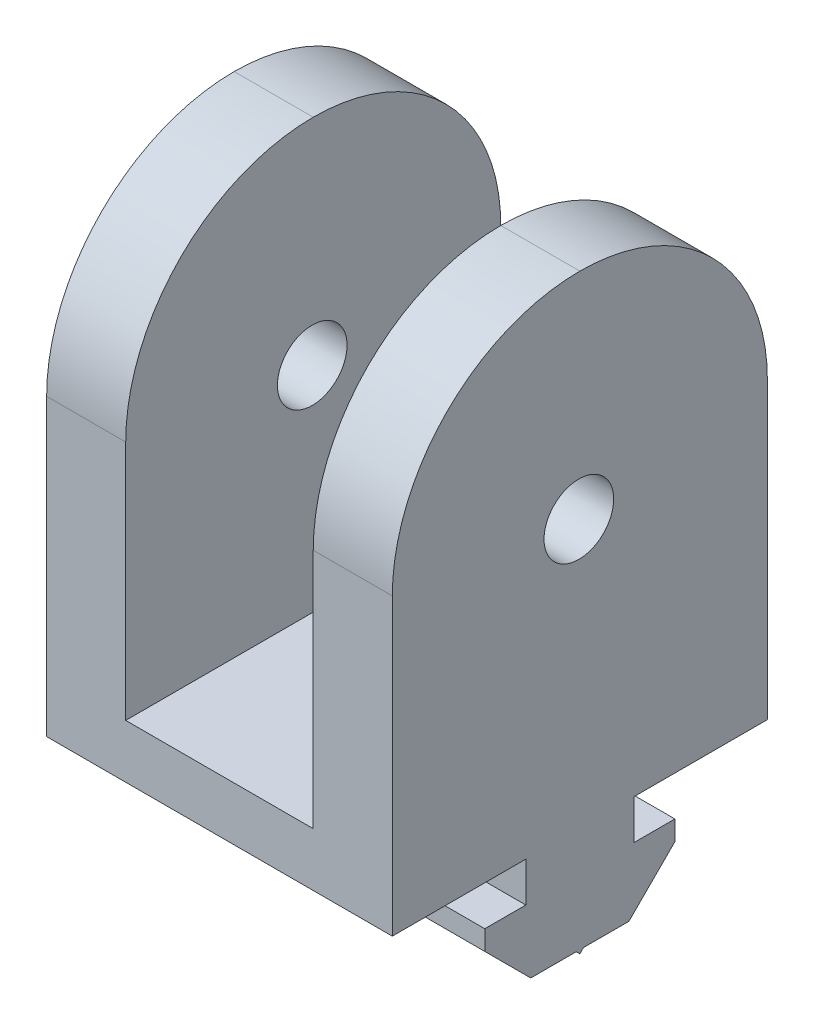
from build123d import *

# Parameters (mm, degrees)
SKETCH1_W           = 150
SKETCH1_H           = 70
BOSS_EXTRUDE1_DEPTH = 10
SKETCH2_W           = 18
SKETCH2_H           = 70
BOSS_EXTRUDE2_DEPTH = 80
FILLET1_R           = 35
SKETCH3_R           = 6.5
CUT_EXTRUDE1_DEPTH  = 164.102034121
RIB1_REACH          = 134.904
SKETCH5_WALL_W      = 321.142477346
SKETCH5_WALL_H      = 40
SKETCH7_W           = 43.830511012
SKETCH7_H           = 10.028409091
CUT_EXTRUDE2_DEPTH  = 80
SCALE1_SCALE        = 0.31
CUT_EXTRUDE5_REACH  = 46.882
SKETCH11_W          = 1.005
SKETCH11_H          = 10.85
SKETCH11_H_2        = 13.95
BOSS_EXTRUDE3_DEPTH = 20


with BuildPart() as part:
    # Sketch1 → Boss-Extrude1 (new body)
    with BuildSketch(Plane(origin=(0, 0, 0), x_dir=(1, 0, 0), z_dir=(0, 1, 0))):
        with Locations((14.225473782, -5.028409091)):
            Rectangle(SKETCH1_W, SKETCH1_H)
    extrude(amount=BOSS_EXTRUDE1_DEPTH)

    # Sketch2 → Boss-Extrude2 (add)
    with BuildSketch(Plane(origin=(0, 10, 0), x_dir=(1, 0, 0), z_dir=(0, 1, 0))):
        with Locations((-31.774526218, -5.028409091)):
            Rectangle(SKETCH2_W, SKETCH2_H)
        with Locations((21.225473782, -5.028409091)):
            Rectangle(SKETCH2_W, SKETCH2_H)
    extrude(amount=BOSS_EXTRUDE2_DEPTH)

    # Fillet1
    fillet1_edges = [part.edges().sort_by_distance(p)[0] for p in [
        (21.225473782, 90, 40.028409091),
        (21.225473782, 90, -29.971590909),
        (-31.774526218, 90, -29.971590909),
        (-31.774526218, 90, 40.028409091),
    ]]
    fillet(fillet1_edges, radius=FILLET1_R - 0.0001)  # a hair under: the kernel refuses the full size

    # Sketch3 → Cut-Extrude1 (cut, through all)
    with BuildSketch(Plane.ZY.offset(40.774526218)):
        with Locations((5.212032143, 50)):
            Circle(SKETCH3_R)
    extrude(amount=-CUT_EXTRUDE1_DEPTH, mode=Mode.SUBTRACT)

    # Sketch5 wall → Rib1 (add, up to next)
    with BuildSketch(Plane(origin=(52.140729288, 25.194278726, 0), x_dir=(0.821802771323, -0.569772064116, 0), z_dir=(0.569772064116, 0.821802771323, 0)), mode=Mode.PRIVATE) as rib1_sk1:
        Rectangle(SKETCH5_WALL_W, SKETCH5_WALL_H)
    rib1_tool1 = extrude(rib1_sk1.sketch, amount=-RIB1_REACH, mode=Mode.PRIVATE) - part.part
    add(rib1_tool1.solids().sort_by_distance((52.140729288, 25.194278726, 0))[0])

    # Sketch7 → Cut-Extrude2 (cut)
    with BuildSketch(Plane(origin=(0, 10, 0), x_dir=(1, 0, 0), z_dir=(0, 1, 0))):
        with Locations((52.140729288, 14.985795454)):
            Rectangle(SKETCH7_W, SKETCH7_H)
    extrude(amount=CUT_EXTRUDE2_DEPTH, mode=Mode.SUBTRACT)


with BuildPart() as part_1:
    # Scale1: scaled about (0, 0, 0)
    add(part.part.scale(SCALE1_SCALE))

    # Sketch11 → Cut-Extrude5 (cut, up to next)
    with BuildSketch(Plane(origin=(0, 0, -9.291193182), x_dir=(-1, 0, 0), z_dir=(0, 0, -1)), mode=Mode.PRIVATE) as cut_extrude5_sk1:
        Polygon((-9.369896872, 3.1), (-8.364896872, 3.1), (-8.364896872, 17.05), (-9.369896872, 17.05), (-9.369896872, 12.52045281), align=None)
    cut_extrude5_tool1 = extrude(cut_extrude5_sk1.sketch, amount=-CUT_EXTRUDE5_REACH, mode=Mode.PRIVATE) & part_1.part
    # Sketch11 → Cut-Extrude5 (cut, up to next)
    with BuildSketch(Plane(origin=(0, 0, -9.291193182), x_dir=(-1, 0, 0), z_dir=(0, 0, -1)), mode=Mode.PRIVATE) as cut_extrude5_sk2:
        with Locations((-8.867396872, 22.475)):
            Rectangle(SKETCH11_W, SKETCH11_H)
    cut_extrude5_tool2 = extrude(cut_extrude5_sk2.sketch, amount=-CUT_EXTRUDE5_REACH, mode=Mode.PRIVATE) & part_1.part
    # Sketch11 → Cut-Extrude5 (cut, up to next)
    with BuildSketch(Plane(origin=(0, 0, -9.291193182), x_dir=(-1, 0, 0), z_dir=(0, 0, -1)), mode=Mode.PRIVATE) as cut_extrude5_sk3:
        Polygon((-22.957355286, 3.1), (-9.369896872, 3.1), (-9.369896872, 12.52045281), align=None)
    cut_extrude5_tool3 = extrude(cut_extrude5_sk3.sketch, amount=-CUT_EXTRUDE5_REACH, mode=Mode.PRIVATE) & part_1.part
    # Sketch11 → Cut-Extrude5 (cut, up to next)
    with BuildSketch(Plane(origin=(0, 0, -9.291193182), x_dir=(-1, 0, 0), z_dir=(0, 0, -1)), mode=Mode.PRIVATE) as cut_extrude5_sk4:
        Polygon((-8.364896872, 0), (-8.364896872, 3.1), (-9.369896872, 3.1), (-22.957355286, 3.1), (-27.659896872, 3.1), (-27.659896872, 0), align=None)
    cut_extrude5_tool4 = extrude(cut_extrude5_sk4.sketch, amount=-CUT_EXTRUDE5_REACH, mode=Mode.PRIVATE) & part_1.part
    # Sketch11 → Cut-Extrude5 (cut, up to next)
    with BuildSketch(Plane(origin=(0, 0, -9.291193182), x_dir=(-1, 0, 0), z_dir=(0, 0, -1)), mode=Mode.PRIVATE) as cut_extrude5_sk5:
        with Locations((12.137603128, 10.075)):
            Rectangle(SKETCH11_W, SKETCH11_H_2)
    cut_extrude5_tool5 = extrude(cut_extrude5_sk5.sketch, amount=-CUT_EXTRUDE5_REACH, mode=Mode.PRIVATE) & part_1.part
    # Sketch11 → Cut-Extrude5 (cut, up to next)
    with BuildSketch(Plane(origin=(0, 0, -9.291193182), x_dir=(-1, 0, 0), z_dir=(0, 0, -1)), mode=Mode.PRIVATE) as cut_extrude5_sk6:
        with Locations((12.137603128, 22.475)):
            Rectangle(SKETCH11_W, SKETCH11_H)
    cut_extrude5_tool6 = extrude(cut_extrude5_sk6.sketch, amount=-CUT_EXTRUDE5_REACH, mode=Mode.PRIVATE) & part_1.part
    # Sketch11 → Cut-Extrude5 (cut, up to next)
    with BuildSketch(Plane(origin=(0, 0, -9.291193182), x_dir=(-1, 0, 0), z_dir=(0, 0, -1)), mode=Mode.PRIVATE) as cut_extrude5_sk7:
        Polygon((12.640103128, 3.1), (11.635103128, 3.1), (11.635103128, 0), (18.840103128, 0), (18.840103128, 3.1), align=None)
    cut_extrude5_tool7 = extrude(cut_extrude5_sk7.sketch, amount=-CUT_EXTRUDE5_REACH, mode=Mode.PRIVATE) & part_1.part
    add(cut_extrude5_tool1.solids().sort_by_distance((8.867397, 10.075, -9.291193))[0], mode=Mode.SUBTRACT)
    add(cut_extrude5_tool2.solids().sort_by_distance((8.867397, 22.475, -9.291193))[0], mode=Mode.SUBTRACT)
    add(cut_extrude5_tool3.solids().sort_by_distance((13.89905, 6.240151, -9.291193))[0], mode=Mode.SUBTRACT)
    add(cut_extrude5_tool4.solids().sort_by_distance((18.012397, 1.55, -9.291193))[0], mode=Mode.SUBTRACT)
    add(cut_extrude5_tool5.solids().sort_by_distance((-12.137603, 10.075, -9.291193))[0], mode=Mode.SUBTRACT)
    add(cut_extrude5_tool6.solids().sort_by_distance((-12.137603, 22.475, -9.291193))[0], mode=Mode.SUBTRACT)
    add(cut_extrude5_tool7.solids().sort_by_distance((-15.237603, 1.55, -9.291193))[0], mode=Mode.SUBTRACT)

    # Sketch13 → Boss-Extrude3 (add)
    with BuildSketch(Plane(origin=(8.364896872, 0, 0), x_dir=(0, 0, -1), z_dir=(1, 0, 0))):
        Polygon((1.566193182, -1.455), (1.566193182, 0), (-4.683806818, 0), (-4.683806818, -1.455), (-4.683806818, -1.8), (-4.683806818, -2.3), (-7.058806818, -2.3), (-7.058806818, -3.439339828), (-4.398146646, -6.1), (-1.768806818, -6.1), (-1.558806818, -6.31), (-1.348806818, -6.1), (1.28053301, -6.1), (3.941193182, -3.439339828), (3.941193182, -2.3), (1.566193182, -2.3), (1.566193182, -1.8), align=None)
    extrude(amount=-BOSS_EXTRUDE3_DEPTH)


solid = part_1.part
